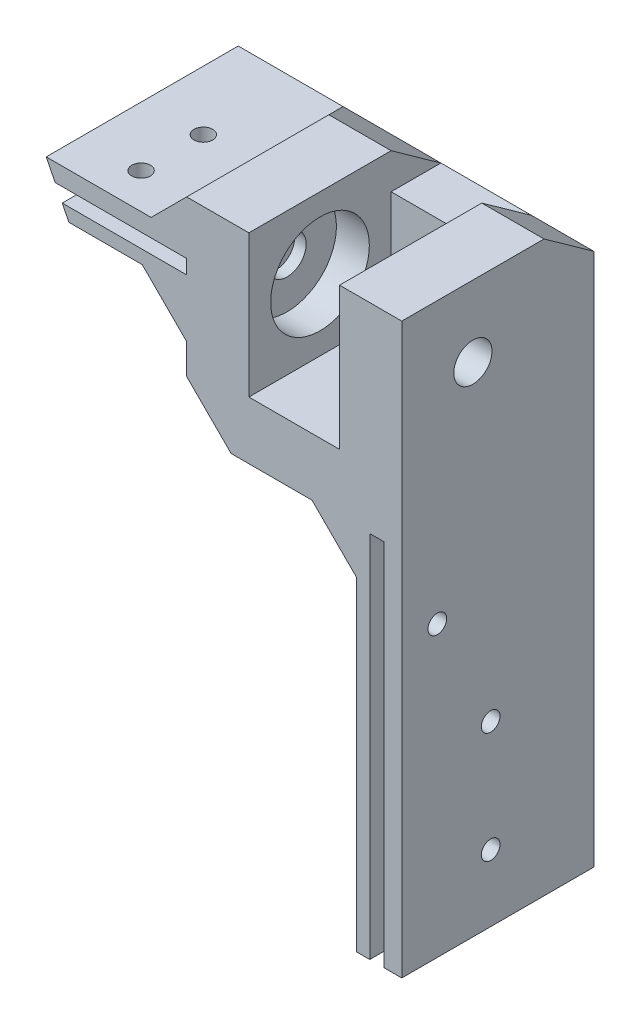
from build123d import *
from OCP.BRepFilletAPI import BRepFilletAPI_MakeChamfer

# Parameters (mm, degrees)
DODANIE_WYCI_GNI_CIE1_DEPTH     = 4
DODANIE_WYCI_GNI_CIE2_DEPTH     = 3.2
DODANIE_WYCI_GNI_CIE3_DEPTH     = 4
DODANIE_WYCI_GNI_CIE4_DEPTH     = 32
WYTNIJ_WYCI_GNI_CIE1_DEPTH      = 17.6
WYTNIJ_WYCI_GNI_CIE1_DEPTH_BACK = 17.6
SZKIC5_R                        = 11.1
SFAZOWANIE1_SIZE                = 11.2
SFAZOWANIE1_SIZE_2              = 8
WYTNIJ_WYCI_GNI_CIE2_DEPTH      = 20.2
WYTNIJ_WYCI_GNI_CIE2_DEPTH_BACK = 140.211637445
SZKIC6_R                        = 4.3
SZKIC7_W                        = 4
SZKIC7_H                        = 83
SZKIC7_W_2                      = 3
DODANIE_WYCI_GNI_CIE5_DEPTH     = 32
SFAZOWANIE2_SIZE                = 10
SFAZOWANIE3_SIZE                = 2
SFAZOWANIE3_SIZE2               = 5.494954839
SZKIC8_R                        = 2.1
OTWORY_TYL_DEPTH                = 143.556234518
SZKIC9_R                        = 3.1
SZKIC9_R_2                      = 2.1
OTWORY_SPOD_DEPTH               = 148.729482501
SZKIC10_R                       = 2.1
OTWORY_BOK_DEPTH                = 146.390095949
SFAZOWANIE4_SIZE                = 8
SZKIC11_W                       = 89.626948643
SZKIC11_H                       = 50.587454561
WYTNIJ_WYCI_GNI_CIE3_DEPTH      = 158.003948995


with BuildPart() as part:
    # Szkic1 → Dodanie-wyciągnięcie1 (new body)
    with BuildSketch(Plane.XY):
        Polygon((0, 0), (80, 0), (20, -120), (0, -120), align=None)
    extrude(amount=DODANIE_WYCI_GNI_CIE1_DEPTH)

    # Szkic2 → Dodanie-wyciągnięcie2 (add)
    with BuildSketch(Plane.XY.offset(4)):
        Polygon((80, 0), (0, 0), (0, -120), (4, -120), (4, -4), (78, -4), align=None)
    extrude(amount=DODANIE_WYCI_GNI_CIE2_DEPTH)

    # Szkic3 → Dodanie-wyciągnięcie3 (add)
    with BuildSketch(Plane.XY.offset(7.2)):
        Polygon((78, -4), (80, 0), (0, 0), (0, -120), (4, -120), (20, -120), align=None)
    extrude(amount=DODANIE_WYCI_GNI_CIE3_DEPTH)

    # Szkic4 → Dodanie-wyciągnięcie4 (add)
    with BuildSketch(Plane.XY.offset(11.2)):
        Polygon((0, 8), (0, -37), (48.4, -37), (48.4, 8), (34.4, 8), (34.4, -24), (14, -24), (14, 8), align=None)
    extrude(amount=DODANIE_WYCI_GNI_CIE4_DEPTH)

    # Szkic5 → Wytnij-wyciągnięcie1 (cut, two sides: drawn at the far end of the back side and taken through both)
    with BuildSketch(Plane(origin=(24.2, 0, 0), x_dir=(0, 0, -1), z_dir=(1, 0, 0)).offset(-WYTNIJ_WYCI_GNI_CIE1_DEPTH_BACK)):
        with Locations(Location((-27.2, -8, 0), (0, 0, 180))):
            Circle(SZKIC5_R)
    extrude(amount=WYTNIJ_WYCI_GNI_CIE1_DEPTH + WYTNIJ_WYCI_GNI_CIE1_DEPTH_BACK, mode=Mode.SUBTRACT)

    # Sfazowanie1
    sfazowanie1_edges_1 = [part.edges().sort_by_distance(p)[0] for p in [
        (7, 0, 11.2),
    ]]
    sfazowanie1_side_1 = [part.faces().sort_by_distance(p)[0] for p in [
        (7, 0, 11.04),
    ]]
    sfazowanie1_edges_2 = [part.edges().sort_by_distance(p)[0] for p in [
        (41.4, 0, 11.2),
    ]]
    sfazowanie1_side_2 = [part.faces().sort_by_distance(p)[0] for p in [
        (41.4, 0, 11.04),
    ]]
    sfazowanie1 = BRepFilletAPI_MakeChamfer(part.part.solid().wrapped)
    for e in sfazowanie1_edges_1:
        sfazowanie1.Add(SFAZOWANIE1_SIZE - 0.0001, SFAZOWANIE1_SIZE_2 - 0.0001, e.wrapped, sfazowanie1_side_1[0].wrapped)
    for e in sfazowanie1_edges_2:
        sfazowanie1.Add(SFAZOWANIE1_SIZE - 0.0001, SFAZOWANIE1_SIZE_2 - 0.0001, e.wrapped, sfazowanie1_side_2[0].wrapped)
    add(Compound.cast(sfazowanie1.Shape()), mode=Mode.REPLACE)  # a hair under: the kernel refuses the full size

    # Szkic6 → Wytnij-wyciągnięcie2 (cut, two sides: drawn at the far end of the back side and taken through both)
    with BuildSketch(Plane(origin=(24.2, 0, 0), x_dir=(0, 0, -1), z_dir=(1, 0, 0)).offset(-WYTNIJ_WYCI_GNI_CIE2_DEPTH_BACK)):
        with Locations((-27.2, -8)):
            Circle(SZKIC6_R)
    extrude(amount=WYTNIJ_WYCI_GNI_CIE2_DEPTH + WYTNIJ_WYCI_GNI_CIE2_DEPTH_BACK, mode=Mode.SUBTRACT)

    # Szkic7 → Dodanie-wyciągnięcie5 (add)
    with BuildSketch(Plane.XY.offset(11.2)):
        with Locations((2, -78.5)):
            Rectangle(SZKIC7_W, SZKIC7_H)
        with Locations((8.7, -78.5)):
            Rectangle(SZKIC7_W_2, SZKIC7_H)
        Polygon((48.4, 0), (80, 0), (78, -4), (48.4, -4), align=None)
        Polygon((48.4, -7.2), (76.4, -7.2), (74.9, -10.2), (48.4, -10.2), align=None)
    extrude(amount=DODANIE_WYCI_GNI_CIE5_DEPTH)

    # Sfazowanie2
    sfazowanie2_edges = [part.edges().sort_by_distance(p)[0] for p in [
        (10.2, -37, 27.2),
        (48.4, -10.2, 27.2),
        (48.4, -37, 27.2),
    ]]
    chamfer(sfazowanie2_edges, length=SFAZOWANIE2_SIZE)

    # Sfazowanie3
    sfazowanie3_edges = [part.edges().sort_by_distance(p)[0] for p in [
        (10.2, -83.5, 11.2),
        (48.4, -23.6, 11.2),
        (29.3, -37, 11.2),
        (66.65, -10.2, 11.2),
        (15.2, -42, 11.2),
        (53.4, -15.2, 11.2),
        (43.4, -32, 11.2),
    ]]
    sfazowanie3_side = [part.faces().sort_by_distance(p)[0] for p in [
        (33.378295522, -61.643653627, 11.2),
    ]]
    chamfer(sfazowanie3_edges, length=SFAZOWANIE3_SIZE, length2=SFAZOWANIE3_SIZE2, reference=sfazowanie3_side[0])

    # Szkic8 → Otwory tyl (cut, through all)
    with BuildSketch(Plane.XZ.offset(10.2)):
        with Locations((66.65, 35.2)):
            Circle(SZKIC8_R)
        with Locations((66.65, 21.2)):
            Circle(SZKIC8_R)
    extrude(amount=-OTWORY_TYL_DEPTH, mode=Mode.SUBTRACT)

    # Szkic9 → Otwory spod (cut, through all)
    with BuildSketch(Plane.XY.offset(11.2)):
        with Locations((60.4, -22.2)):
            Circle(SZKIC9_R)
        with Locations((22.2, -49)):
            Circle(SZKIC9_R_2)
        with Locations((22.2, -89)):
            Circle(SZKIC9_R_2)
        with Locations((36.2, -49)):
            Circle(SZKIC9_R_2)
    extrude(amount=-OTWORY_SPOD_DEPTH, mode=Mode.SUBTRACT)

    # Szkic10 → Otwory bok (cut, through all)
    with BuildSketch(Plane(origin=(10.2, 0, 0), x_dir=(0, 0, -1), z_dir=(1, 0, 0))):
        with Locations(Location((-23.2, -80, 0), (0, 0, 90))):
            Circle(SZKIC10_R)
        with Locations(Location((-35.2, -55, 0), (0, 0, 90))):
            Circle(SZKIC10_R)
        with Locations(Location((-23.2, -105, 0), (0, 0, 90))):
            Circle(SZKIC10_R)
    extrude(amount=-OTWORY_BOK_DEPTH, mode=Mode.SUBTRACT)

    # Sfazowanie4
    sfazowanie4_edges = [part.edges().sort_by_distance(p)[0] for p in [
        (48.4, 0, 21.60005),
    ]]
    chamfer(sfazowanie4_edges, length=SFAZOWANIE4_SIZE - 0.0001)  # a hair under: the kernel refuses the full size


with BuildPart() as body_2:
    # Lustro1: mirrored copy
    add(part.part.mirror(Plane(origin=(0, 0, 4), x_dir=(0, 0, 1), z_dir=(1, 0, 0))))


with BuildPart() as part_1:
    add(part.part)

    # Szkic11 → Wytnij-wyciągnięcie3 (cut, through all)
    with BuildSketch(Plane.XZ.offset(120)):
        with Locations((44.813474322, 25.293727281)):
            Rectangle(SZKIC11_W, SZKIC11_H)
    extrude(amount=-WYTNIJ_WYCI_GNI_CIE3_DEPTH, mode=Mode.SUBTRACT)


solid = body_2.part
